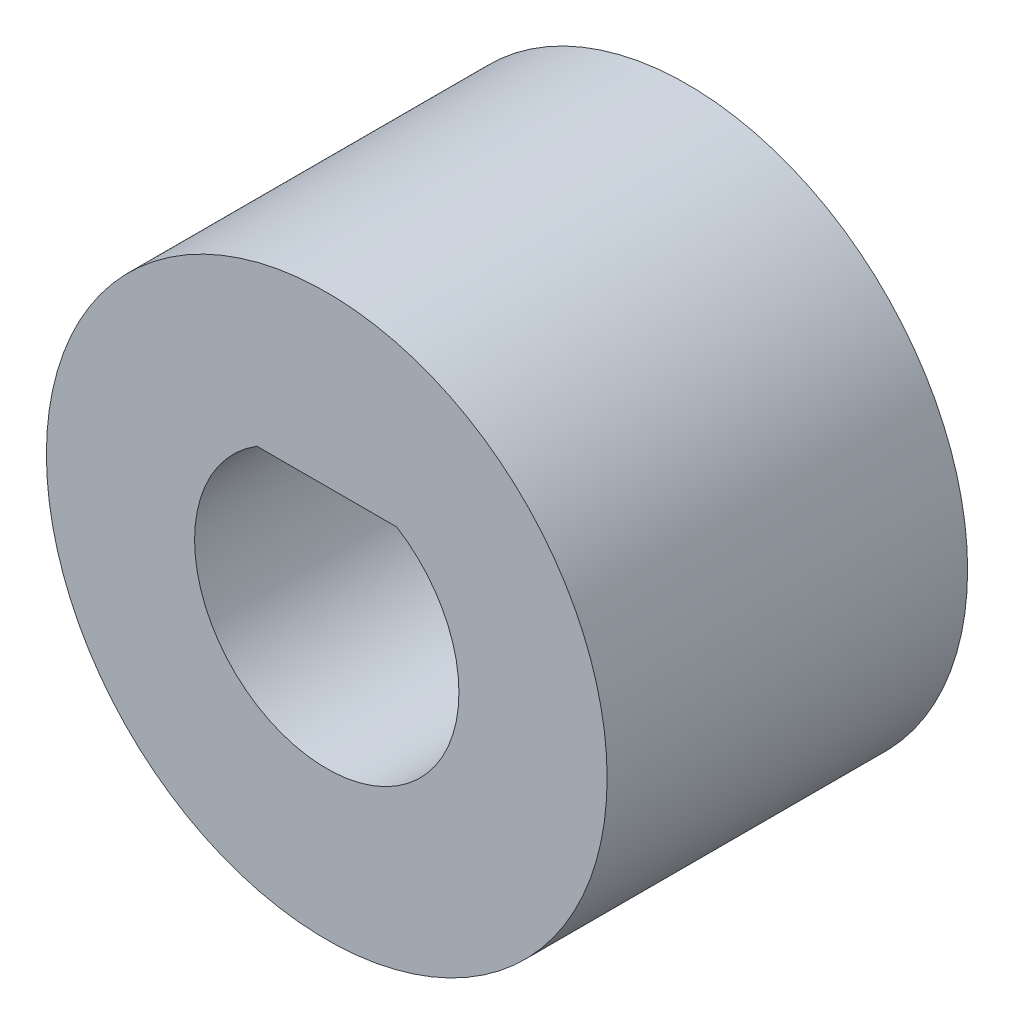
from build123d import *

# Parameters (mm, degrees)
ESQUISSE1_R        = 7
BOSS_EXTRU_1_DEPTH = 9


with BuildPart() as part:
    # Esquisse1 → Boss.-Extru.1 (new body)
    with BuildSketch(Plane.XY):
        Circle(ESQUISSE1_R)
        with BuildLine():
            Line((-1.74642492, 2.8), (1.74642492, 2.8))
            ThreePointArc((1.74642492, 2.8), (0, -3.3), (-1.74642492, 2.8))
        make_face(mode=Mode.SUBTRACT)
    extrude(amount=BOSS_EXTRU_1_DEPTH)


solid = part.part
